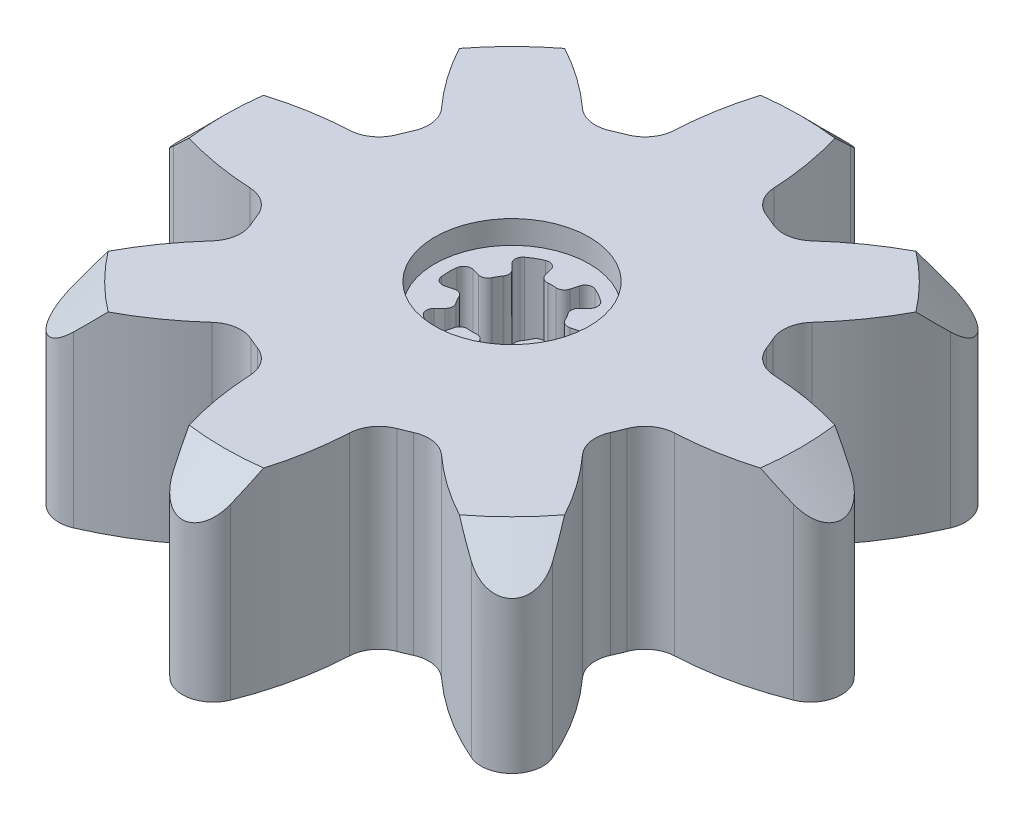
from build123d import *
from build123d.topology import SkipClean

# Parameters (mm, degrees)
SKETCH1_R               = 23.65
BOSS_EXTRUDE1_DEPTH     = 12.5
CHAMFER1_SIZE           = 5
CUT_EXTRUDE1_DEPTH      = 36.705671818
CUT_EXTRUDE3_DEPTH      = 9
CUT_EXTRUDE4_DEPTH      = 36.705671986
BOSS_EXTRUDE2_START     = 5
SKETCH3_5_R             = 5
BOSS_EXTRUDE2_DEPTH     = 5
CUT_EXTRUDE5_START      = -11
SKETCH3_7_R             = 5
CUT_EXTRUDE5_DEPTH      = 25.705671986
FILLET2_R               = 0.5
CUT_EXTRUDE6_DEPTH      = 38.747781517
CUT_EXTRUDE6_DEPTH_BACK = 38.747781517
FILLET3_R               = 2
FILLET4_R               = 2


with BuildPart() as part:
    # Sketch1 → Boss-Extrude1 (new body)
    with BuildSketch(Plane(origin=(0, 0, 0), x_dir=(1, 0, 0), z_dir=(0, 1, 0))):
        Circle(SKETCH1_R)
    extrude(amount=BOSS_EXTRUDE1_DEPTH)

    # Chamfer1
    chamfer1_edges = [part.edges().sort_by_distance(p)[0] for p in [
        (-23.65, 12.5, 0),
    ]]
    chamfer(chamfer1_edges, length=CHAMFER1_SIZE)

    # Sketch2 → Cut-Extrude1 (cut, through all)
    with BuildSketch(Plane(origin=(0, 12.5, 0), x_dir=(1, 0, 0), z_dir=(0, 1, 0))):
        with BuildLine():
            ThreePointArc((16.723075375, 16.723075375), (14.761157334, 11.338625506), (11.338457236, 6.742263159))
            Line((11.338457236, 6.742263159), (11.041486685, 6.445292607))
            ThreePointArc((11.041486685, 6.445292607), (11.811799823, 4.892607683), (12.365020218, 3.25))
            Line((12.365020218, 3.25), (12.785, 3.25))
            ThreePointArc((12.785, 3.25), (18.455333434, 2.420095464), (23.65, 0))
            ThreePointArc((23.65, 0), (21.849750944, 9.050463175), (16.723075375, 16.723075375))
        make_face()
        with BuildLine():
            ThreePointArc((6.742263159, 11.338457236), (11.338625506, 14.761157334), (16.723075375, 16.723075375))
            ThreePointArc((16.723075375, 16.723075375), (9.050463175, 21.849750944), (0, 23.65))
            ThreePointArc((0, 23.65), (2.420095464, 18.455333434), (3.25, 12.785))
            Line((3.25, 12.785), (3.25, 12.365020218))
            ThreePointArc((3.25, 12.365020218), (4.892607683, 11.811799823), (6.445292607, 11.041486685))
            Line((6.445292607, 11.041486685), (6.742263159, 11.338457236))
        make_face()
        with BuildLine():
            ThreePointArc((16.723075375, -16.723075375), (21.849750944, -9.050463175), (23.65, 0))
            ThreePointArc((23.65, 0), (18.455333434, -2.420095464), (12.785, -3.25))
            Line((12.785, -3.25), (12.365020218, -3.25))
            ThreePointArc((12.365020218, -3.25), (11.811799823, -4.892607683), (11.041486685, -6.445292607))
            Line((11.041486685, -6.445292607), (11.338457236, -6.742263159))
            ThreePointArc((11.338457236, -6.742263159), (14.761157334, -11.338625506), (16.723075375, -16.723075375))
        make_face()
        with BuildLine():
            ThreePointArc((-3.25, 12.785), (-2.420095464, 18.455333434), (0, 23.65))
            ThreePointArc((0, 23.65), (-9.050463175, 21.849750944), (-16.723075375, 16.723075375))
            ThreePointArc((-16.723075375, 16.723075375), (-11.338625506, 14.761157334), (-6.742263159, 11.338457236))
            Line((-6.742263159, 11.338457236), (-6.445292607, 11.041486685))
            ThreePointArc((-6.445292607, 11.041486685), (-4.892607683, 11.811799823), (-3.25, 12.365020218))
            Line((-3.25, 12.365020218), (-3.25, 12.785))
        make_face()
        with BuildLine():
            ThreePointArc((0, -23.65), (9.050463175, -21.849750944), (16.723075375, -16.723075375))
            ThreePointArc((16.723075375, -16.723075375), (11.338625506, -14.761157334), (6.742263159, -11.338457236))
            Line((6.742263159, -11.338457236), (6.445292607, -11.041486685))
            ThreePointArc((6.445292607, -11.041486685), (4.892607683, -11.811799823), (3.25, -12.365020218))
            Line((3.25, -12.365020218), (3.25, -12.785))
            ThreePointArc((3.25, -12.785), (2.420095464, -18.455333434), (0, -23.65))
        make_face()
        with BuildLine():
            ThreePointArc((-11.338457236, 6.742263159), (-14.761157334, 11.338625506), (-16.723075375, 16.723075375))
            ThreePointArc((-16.723075375, 16.723075375), (-21.849750944, 9.050463175), (-23.65, 0))
            ThreePointArc((-23.65, 0), (-18.455333434, 2.420095464), (-12.785, 3.25))
            Line((-12.785, 3.25), (-12.365020218, 3.25))
            ThreePointArc((-12.365020218, 3.25), (-11.811799823, 4.892607683), (-11.041486685, 6.445292607))
            Line((-11.041486685, 6.445292607), (-11.338457236, 6.742263159))
        make_face()
        with BuildLine():
            ThreePointArc((-16.723075375, -16.723075375), (-9.050463175, -21.849750944), (0, -23.65))
            ThreePointArc((0, -23.65), (-2.420095464, -18.455333434), (-3.25, -12.785))
            Line((-3.25, -12.785), (-3.25, -12.365020218))
            ThreePointArc((-3.25, -12.365020218), (-4.892607683, -11.811799823), (-6.445292607, -11.041486685))
            Line((-6.445292607, -11.041486685), (-6.742263159, -11.338457236))
            ThreePointArc((-6.742263159, -11.338457236), (-11.338625506, -14.761157334), (-16.723075375, -16.723075375))
        make_face()
        with BuildLine():
            ThreePointArc((-12.785, -3.25), (-18.455333434, -2.420095464), (-23.65, 0))
            ThreePointArc((-23.65, 0), (-21.849750944, -9.050463175), (-16.723075375, -16.723075375))
            ThreePointArc((-16.723075375, -16.723075375), (-14.761157334, -11.338625506), (-11.338457236, -6.742263159))
            Line((-11.338457236, -6.742263159), (-11.041486685, -6.445292607))
            ThreePointArc((-11.041486685, -6.445292607), (-11.811799823, -4.892607683), (-12.365020218, -3.25))
            Line((-12.365020218, -3.25), (-12.785, -3.25))
        make_face()
    extrude(amount=-CUT_EXTRUDE1_DEPTH, mode=Mode.SUBTRACT)

    # Sketch3 → Cut-Extrude3 (cut)
    with BuildSketch(Plane.XZ):
        with BuildLine():
            Line((1.061158085, 3.960295888), (0.672929517, 2.511407148))
            ThreePointArc((0.672929517, 2.511407148), (0, 2.6), (-0.672929517, 2.511407148))
            Line((-0.672929517, 2.511407148), (-1.061158085, 3.960295888))
            ThreePointArc((-1.061158085, 3.960295888), (-2.05, 3.550704156), (-2.899137803, 2.899137803))
            Line((-2.899137803, 2.899137803), (-1.838477631, 1.838477631))
            ThreePointArc((-1.838477631, 1.838477631), (-2.25166605, 1.3), (-2.511407148, 0.672929517))
            Line((-2.511407148, 0.672929517), (-3.960295888, 1.061158085))
            ThreePointArc((-3.960295888, 1.061158085), (-4.1, 0), (-3.960295888, -1.061158085))
            Line((-3.960295888, -1.061158085), (-2.511407148, -0.672929517))
            ThreePointArc((-2.511407148, -0.672929517), (-2.25166605, -1.3), (-1.838477631, -1.838477631))
            Line((-1.838477631, -1.838477631), (-2.899137803, -2.899137803))
            ThreePointArc((-2.899137803, -2.899137803), (-2.05, -3.550704156), (-1.061158085, -3.960295888))
            Line((-1.061158085, -3.960295888), (-0.672929517, -2.511407148))
            ThreePointArc((-0.672929517, -2.511407148), (0, -2.6), (0.672929517, -2.511407148))
            Line((0.672929517, -2.511407148), (1.061158085, -3.960295888))
            ThreePointArc((1.061158085, -3.960295888), (2.05, -3.550704156), (2.899137803, -2.899137803))
            Line((2.899137803, -2.899137803), (1.838477631, -1.838477631))
            ThreePointArc((1.838477631, -1.838477631), (2.25166605, -1.3), (2.511407148, -0.672929517))
            Line((2.511407148, -0.672929517), (3.960295888, -1.061158085))
            ThreePointArc((3.960295888, -1.061158085), (4.1, 0), (3.960295888, 1.061158085))
            Line((3.960295888, 1.061158085), (2.511407148, 0.672929517))
            ThreePointArc((2.511407148, 0.672929517), (2.25166605, 1.3), (1.838477631, 1.838477631))
            Line((1.838477631, 1.838477631), (2.899137803, 2.899137803))
            ThreePointArc((2.899137803, 2.899137803), (2.05, 3.550704156), (1.061158085, 3.960295888))
        make_face()
        with BuildLine():
            Line((4.301795716, 2.54844141), (9.819871729, 4.844854922))
            ThreePointArc((9.819871729, 4.844854922), (9.594019108, 5.278001265), (9.349072854, 5.70064354))
            ThreePointArc((9.349072854, 5.70064354), (9.209371452, 6.335099743), (9.488977032, 6.921505638))
            ThreePointArc((9.488977032, 6.921505638), (12.083864169, 10.129242791), (14.021999626, 13.771583776))
            ThreePointArc((14.021999626, 13.771583776), (13.979017454, 13.989358062), (13.761438196, 14.03331683))
            ThreePointArc((13.761438196, 14.03331683), (10.106194816, 12.10405139), (6.88994001, 9.508174981))
            ThreePointArc((6.88994001, 9.508174981), (6.305066553, 9.228736664), (5.671709274, 9.36665436))
            ThreePointArc((5.671709274, 9.36665436), (5.247197229, 9.610901167), (4.812188077, 9.835921203))
            Line((4.812188077, 9.835921203), (2.534128676, 4.310242667))
            ThreePointArc((2.534128676, 4.310242667), (3.529653169, 3.541404878), (4.301795716, 2.54844141))
        make_face()
        with BuildLine():
            ThreePointArc((10.633728904, 2.612720726), (10.506262131, 3.085604645), (10.357777404, 3.55231576))
            Line((10.357777404, 3.55231576), (4.83970139, 1.255902247))
            ThreePointArc((4.83970139, 1.255902247), (4.999993095, 0.008309713), (4.843849124, -1.23980872))
            Line((4.843849124, -1.23980872), (10.36952766, -3.517868121))
            ThreePointArc((10.36952766, -3.517868121), (10.516106456, -3.051885485), (10.641756517, -2.579829109))
            ThreePointArc((10.641756517, -2.579829109), (10.991600992, -2.032417017), (11.603963579, -1.815476434))
            ThreePointArc((11.603963579, -1.815476434), (15.707038563, -1.382126031), (19.653031297, -0.177070746))
            ThreePointArc((19.653031297, -0.177070746), (19.776627986, 0.007311914), (19.653859761, 0.192247226))
            ThreePointArc((19.653859761, 0.192247226), (15.705015704, 1.412697932), (11.595218309, 1.851371703))
            ThreePointArc((11.595218309, 1.851371703), (10.984057593, 2.067346962), (10.633728904, 2.612720726))
        make_face()
        with BuildLine():
            ThreePointArc((-1.255902247, 4.83970139), (-0.008309713, 4.999993095), (1.23980872, 4.843849124))
            Line((1.23980872, 4.843849124), (3.517868121, 10.36952766))
            ThreePointArc((3.517868121, 10.36952766), (3.051885485, 10.516106456), (2.579829109, 10.641756517))
            ThreePointArc((2.579829109, 10.641756517), (2.032417017, 10.991600992), (1.815476434, 11.603963579))
            ThreePointArc((1.815476434, 11.603963579), (1.382126031, 15.707038563), (0.177070746, 19.653031297))
            ThreePointArc((0.177070746, 19.653031297), (-0.007311914, 19.776627986), (-0.192247226, 19.653859761))
            ThreePointArc((-0.192247226, 19.653859761), (-1.412697932, 15.705015704), (-1.851371703, 11.595218309))
            ThreePointArc((-1.851371703, 11.595218309), (-2.067346962, 10.984057593), (-2.612720726, 10.633728904))
            ThreePointArc((-2.612720726, 10.633728904), (-3.085604645, 10.506262131), (-3.55231576, 10.357777404))
            Line((-3.55231576, 10.357777404), (-1.255902247, 4.83970139))
        make_face()
        with BuildLine():
            Line((9.835921203, -4.812188077), (4.310242667, -2.534128676))
            ThreePointArc((4.310242667, -2.534128676), (3.541404878, -3.529653169), (2.54844141, -4.301795716))
            Line((2.54844141, -4.301795716), (4.844854922, -9.819871729))
            ThreePointArc((4.844854922, -9.819871729), (5.278001265, -9.594019108), (5.70064354, -9.349072854))
            ThreePointArc((5.70064354, -9.349072854), (6.335099743, -9.209371452), (6.921505638, -9.488977032))
            ThreePointArc((6.921505638, -9.488977032), (10.129242791, -12.083864169), (13.771583776, -14.021999626))
            ThreePointArc((13.771583776, -14.021999626), (13.989358062, -13.979017454), (14.03331683, -13.761438196))
            ThreePointArc((14.03331683, -13.761438196), (12.10405139, -10.106194816), (9.508174981, -6.88994001))
            ThreePointArc((9.508174981, -6.88994001), (9.228736664, -6.305066553), (9.36665436, -5.671709274))
            ThreePointArc((9.36665436, -5.671709274), (9.610901167, -5.247197229), (9.835921203, -4.812188077))
        make_face()
        with BuildLine():
            ThreePointArc((-4.310242667, 2.534128676), (-3.541404878, 3.529653169), (-2.54844141, 4.301795716))
            Line((-2.54844141, 4.301795716), (-4.844854922, 9.819871729))
            ThreePointArc((-4.844854922, 9.819871729), (-5.278001265, 9.594019108), (-5.70064354, 9.349072854))
            ThreePointArc((-5.70064354, 9.349072854), (-6.335099743, 9.209371452), (-6.921505638, 9.488977032))
            ThreePointArc((-6.921505638, 9.488977032), (-10.129242791, 12.083864169), (-13.771583776, 14.021999626))
            ThreePointArc((-13.771583776, 14.021999626), (-13.989358062, 13.979017454), (-14.03331683, 13.761438196))
            ThreePointArc((-14.03331683, 13.761438196), (-12.10405139, 10.106194816), (-9.508174981, 6.88994001))
            ThreePointArc((-9.508174981, 6.88994001), (-9.228736664, 6.305066553), (-9.36665436, 5.671709274))
            ThreePointArc((-9.36665436, 5.671709274), (-9.610901167, 5.247197229), (-9.835921203, 4.812188077))
            Line((-9.835921203, 4.812188077), (-4.310242667, 2.534128676))
        make_face()
        with BuildLine():
            Line((3.55231576, -10.357777404), (1.255902247, -4.83970139))
            ThreePointArc((1.255902247, -4.83970139), (0.008309713, -4.999993095), (-1.23980872, -4.843849124))
            Line((-1.23980872, -4.843849124), (-3.517868121, -10.36952766))
            ThreePointArc((-3.517868121, -10.36952766), (-3.051885485, -10.516106456), (-2.579829109, -10.641756517))
            ThreePointArc((-2.579829109, -10.641756517), (-2.032417017, -10.991600992), (-1.815476434, -11.603963579))
            ThreePointArc((-1.815476434, -11.603963579), (-1.382126031, -15.707038563), (-0.177070746, -19.653031297))
            ThreePointArc((-0.177070746, -19.653031297), (0.007311914, -19.776627986), (0.192247226, -19.653859761))
            ThreePointArc((0.192247226, -19.653859761), (1.412697932, -15.705015704), (1.851371703, -11.595218309))
            ThreePointArc((1.851371703, -11.595218309), (2.067346962, -10.984057593), (2.612720726, -10.633728904))
            ThreePointArc((2.612720726, -10.633728904), (3.085604645, -10.506262131), (3.55231576, -10.357777404))
        make_face()
        with BuildLine():
            ThreePointArc((-4.83970139, -1.255902247), (-4.999993095, -0.008309713), (-4.843849124, 1.23980872))
            Line((-4.843849124, 1.23980872), (-10.36952766, 3.517868121))
            ThreePointArc((-10.36952766, 3.517868121), (-10.516106456, 3.051885485), (-10.641756517, 2.579829109))
            ThreePointArc((-10.641756517, 2.579829109), (-10.991600992, 2.032417017), (-11.603963579, 1.815476434))
            ThreePointArc((-11.603963579, 1.815476434), (-15.707038563, 1.382126031), (-19.653031297, 0.177070746))
            ThreePointArc((-19.653031297, 0.177070746), (-19.776627986, -0.007311914), (-19.653859761, -0.192247226))
            ThreePointArc((-19.653859761, -0.192247226), (-15.705015704, -1.412697932), (-11.595218309, -1.851371703))
            ThreePointArc((-11.595218309, -1.851371703), (-10.984057593, -2.067346962), (-10.633728904, -2.612720726))
            ThreePointArc((-10.633728904, -2.612720726), (-10.506262131, -3.085604645), (-10.357777404, -3.55231576))
            Line((-10.357777404, -3.55231576), (-4.83970139, -1.255902247))
        make_face()
        with BuildLine():
            Line((-4.812188077, -9.835921203), (-2.534128676, -4.310242667))
            ThreePointArc((-2.534128676, -4.310242667), (-3.529653169, -3.541404878), (-4.301795716, -2.54844141))
            Line((-4.301795716, -2.54844141), (-9.819871729, -4.844854922))
            ThreePointArc((-9.819871729, -4.844854922), (-9.594019108, -5.278001265), (-9.349072854, -5.70064354))
            ThreePointArc((-9.349072854, -5.70064354), (-9.209371452, -6.335099743), (-9.488977032, -6.921505638))
            ThreePointArc((-9.488977032, -6.921505638), (-12.083864169, -10.129242791), (-14.021999626, -13.771583776))
            ThreePointArc((-14.021999626, -13.771583776), (-13.979017454, -13.989358062), (-13.761438196, -14.03331683))
            ThreePointArc((-13.761438196, -14.03331683), (-10.106194816, -12.10405139), (-6.88994001, -9.508174981))
            ThreePointArc((-6.88994001, -9.508174981), (-6.305066553, -9.228736664), (-5.671709274, -9.36665436))
            ThreePointArc((-5.671709274, -9.36665436), (-5.247197229, -9.610901167), (-4.812188077, -9.835921203))
        make_face()
    extrude(amount=-CUT_EXTRUDE3_DEPTH, mode=Mode.SUBTRACT)

    # Sketch3<4> → Cut-Extrude4 (cut, through all)
    with BuildSketch(Plane.XZ):
        with BuildLine():
            Line((1.061158085, 3.960295888), (0.672929517, 2.511407148))
            ThreePointArc((0.672929517, 2.511407148), (0, 2.6), (-0.672929517, 2.511407148))
            Line((-0.672929517, 2.511407148), (-1.061158085, 3.960295888))
            ThreePointArc((-1.061158085, 3.960295888), (-2.05, 3.550704156), (-2.899137803, 2.899137803))
            Line((-2.899137803, 2.899137803), (-1.838477631, 1.838477631))
            ThreePointArc((-1.838477631, 1.838477631), (-2.25166605, 1.3), (-2.511407148, 0.672929517))
            Line((-2.511407148, 0.672929517), (-3.960295888, 1.061158085))
            ThreePointArc((-3.960295888, 1.061158085), (-4.1, 0), (-3.960295888, -1.061158085))
            Line((-3.960295888, -1.061158085), (-2.511407148, -0.672929517))
            ThreePointArc((-2.511407148, -0.672929517), (-2.25166605, -1.3), (-1.838477631, -1.838477631))
            Line((-1.838477631, -1.838477631), (-2.899137803, -2.899137803))
            ThreePointArc((-2.899137803, -2.899137803), (-2.05, -3.550704156), (-1.061158085, -3.960295888))
            Line((-1.061158085, -3.960295888), (-0.672929517, -2.511407148))
            ThreePointArc((-0.672929517, -2.511407148), (0, -2.6), (0.672929517, -2.511407148))
            Line((0.672929517, -2.511407148), (1.061158085, -3.960295888))
            ThreePointArc((1.061158085, -3.960295888), (2.05, -3.550704156), (2.899137803, -2.899137803))
            Line((2.899137803, -2.899137803), (1.838477631, -1.838477631))
            ThreePointArc((1.838477631, -1.838477631), (2.25166605, -1.3), (2.511407148, -0.672929517))
            Line((2.511407148, -0.672929517), (3.960295888, -1.061158085))
            ThreePointArc((3.960295888, -1.061158085), (4.064923932, -0.535157388), (4.1, 0))
            ThreePointArc((4.1, 0), (4.064923932, 0.535157388), (3.960295888, 1.061158085))
            Line((3.960295888, 1.061158085), (2.511407148, 0.672929517))
            ThreePointArc((2.511407148, 0.672929517), (2.25166605, 1.3), (1.838477631, 1.838477631))
            Line((1.838477631, 1.838477631), (2.899137803, 2.899137803))
            ThreePointArc((2.899137803, 2.899137803), (2.05, 3.550704156), (1.061158085, 3.960295888))
        make_face()
    extrude(amount=-CUT_EXTRUDE4_DEPTH, mode=Mode.SUBTRACT)

    # Sketch3<5> → Boss-Extrude2 (add)
    with SkipClean():  # the faces are left unmerged after this step: merging them gives an invalid solid
        with BuildSketch(Plane.XZ.offset(BOSS_EXTRUDE2_START)):
            Circle(SKETCH3_5_R)
            with BuildLine():
                ThreePointArc((-0.672929517, 2.511407148), (0, 2.6), (0.672929517, 2.511407148))
                Line((0.672929517, 2.511407148), (1.061158085, 3.960295888))
                ThreePointArc((1.061158085, 3.960295888), (2.05, 3.550704156), (2.899137803, 2.899137803))
                Line((2.899137803, 2.899137803), (1.838477631, 1.838477631))
                ThreePointArc((1.838477631, 1.838477631), (2.25166605, 1.3), (2.511407148, 0.672929517))
                Line((2.511407148, 0.672929517), (3.960295888, 1.061158085))
                ThreePointArc((3.960295888, 1.061158085), (4.1, 0), (3.960295888, -1.061158085))
                Line((3.960295888, -1.061158085), (2.511407148, -0.672929517))
                ThreePointArc((2.511407148, -0.672929517), (2.25166605, -1.3), (1.838477631, -1.838477631))
                Line((1.838477631, -1.838477631), (2.899137803, -2.899137803))
                ThreePointArc((2.899137803, -2.899137803), (2.05, -3.550704156), (1.061158085, -3.960295888))
                Line((1.061158085, -3.960295888), (0.672929517, -2.511407148))
                ThreePointArc((0.672929517, -2.511407148), (0, -2.6), (-0.672929517, -2.511407148))
                Line((-0.672929517, -2.511407148), (-1.061158085, -3.960295888))
                ThreePointArc((-1.061158085, -3.960295888), (-2.05, -3.550704156), (-2.899137803, -2.899137803))
                Line((-2.899137803, -2.899137803), (-1.838477631, -1.838477631))
                ThreePointArc((-1.838477631, -1.838477631), (-2.25166605, -1.3), (-2.511407148, -0.672929517))
                Line((-2.511407148, -0.672929517), (-3.960295888, -1.061158085))
                ThreePointArc((-3.960295888, -1.061158085), (-4.1, 0), (-3.960295888, 1.061158085))
                Line((-3.960295888, 1.061158085), (-2.511407148, 0.672929517))
                ThreePointArc((-2.511407148, 0.672929517), (-2.25166605, 1.3), (-1.838477631, 1.838477631))
                Line((-1.838477631, 1.838477631), (-2.899137803, 2.899137803))
                ThreePointArc((-2.899137803, 2.899137803), (-2.05, 3.550704156), (-1.061158085, 3.960295888))
                Line((-1.061158085, 3.960295888), (-0.672929517, 2.511407148))
            make_face(mode=Mode.SUBTRACT)
        extrude(amount=-BOSS_EXTRUDE2_DEPTH)

    # Sketch3<7> → Cut-Extrude5 (cut, through all)
    with SkipClean():  # the faces are left unmerged after this step: merging them gives an invalid solid
        with BuildSketch(Plane.XZ.offset(CUT_EXTRUDE5_START)):
            Circle(SKETCH3_7_R)
            with BuildLine():
                ThreePointArc((-0.672929517, 2.511407148), (0, 2.6), (0.672929517, 2.511407148))
                Line((0.672929517, 2.511407148), (1.061158085, 3.960295888))
                ThreePointArc((1.061158085, 3.960295888), (2.05, 3.550704156), (2.899137803, 2.899137803))
                Line((2.899137803, 2.899137803), (1.838477631, 1.838477631))
                ThreePointArc((1.838477631, 1.838477631), (2.25166605, 1.3), (2.511407148, 0.672929517))
                Line((2.511407148, 0.672929517), (3.960295888, 1.061158085))
                ThreePointArc((3.960295888, 1.061158085), (4.1, 0), (3.960295888, -1.061158085))
                Line((3.960295888, -1.061158085), (2.511407148, -0.672929517))
                ThreePointArc((2.511407148, -0.672929517), (2.25166605, -1.3), (1.838477631, -1.838477631))
                Line((1.838477631, -1.838477631), (2.899137803, -2.899137803))
                ThreePointArc((2.899137803, -2.899137803), (2.05, -3.550704156), (1.061158085, -3.960295888))
                Line((1.061158085, -3.960295888), (0.672929517, -2.511407148))
                ThreePointArc((0.672929517, -2.511407148), (0, -2.6), (-0.672929517, -2.511407148))
                Line((-0.672929517, -2.511407148), (-1.061158085, -3.960295888))
                ThreePointArc((-1.061158085, -3.960295888), (-2.05, -3.550704156), (-2.899137803, -2.899137803))
                Line((-2.899137803, -2.899137803), (-1.838477631, -1.838477631))
                ThreePointArc((-1.838477631, -1.838477631), (-2.25166605, -1.3), (-2.511407148, -0.672929517))
                Line((-2.511407148, -0.672929517), (-3.960295888, -1.061158085))
                ThreePointArc((-3.960295888, -1.061158085), (-4.1, 0), (-3.960295888, 1.061158085))
                Line((-3.960295888, 1.061158085), (-2.511407148, 0.672929517))
                ThreePointArc((-2.511407148, 0.672929517), (-2.25166605, 1.3), (-1.838477631, 1.838477631))
                Line((-1.838477631, 1.838477631), (-2.899137803, 2.899137803))
                ThreePointArc((-2.899137803, 2.899137803), (-2.05, 3.550704156), (-1.061158085, 3.960295888))
                Line((-1.061158085, 3.960295888), (-0.672929517, 2.511407148))
            make_face(mode=Mode.SUBTRACT)
        extrude(amount=-CUT_EXTRUDE5_DEPTH, mode=Mode.SUBTRACT)

    # Fillet2
    fillet2_edges = [part.edges().sort_by_distance(p)[0] for p in [
        (-2.511407148, 5.5, -0.672929517),
        (2.511407148, 5.5, 0.672929517),
        (0.672929517, 5.5, 2.511407148),
        (-0.672929517, 5.5, -2.511407148),
        (-1.838477631, 5.5, 1.838477631),
        (1.838477631, 5.5, -1.838477631),
        (-2.899137803, 5.5, 2.899137803),
        (2.899137803, 5.5, -2.899137803),
        (-1.061158085, 5.5, 3.960295888),
        (1.061158085, 5.5, -3.960295888),
        (-3.960295888, 5.5, -1.061158085),
        (3.960295888, 5.5, 1.061158085),
        (2.899137803, 5.5, 2.899137803),
        (-2.899137803, 5.5, -2.899137803),
        (1.061158085, 5.5, 3.960295888),
        (-1.061158085, 5.5, -3.960295888),
        (-0.672929517, 5.5, 2.511407148),
        (0.672929517, 5.5, -2.511407148),
        (-3.960295888, 5.5, 1.061158085),
        (3.960295888, 5.5, -1.061158085),
        (1.838477631, 5.5, 1.838477631),
        (-1.838477631, 5.5, -1.838477631),
        (-2.511407148, 5.5, 0.672929517),
        (2.511407148, 5.5, -0.672929517),
    ]]
    fillet(fillet2_edges, radius=FILLET2_R)

    # Sketch5 → Cut-Extrude6 (cut, two sides: drawn at the far end of the back side and taken through both)
    with SkipClean():  # the faces are left unmerged after this step: merging them gives an invalid solid
        with BuildSketch(Plane(origin=(0, 12.5, 0), x_dir=(1, 0, 0), z_dir=(0, 1, 0)).offset(-CUT_EXTRUDE6_DEPTH_BACK)):
            with BuildLine():
                ThreePointArc((0.003500293, 20.98513785), (-0.703606488, 19.278031069), (1.003500293, 19.98513785))
                ThreePointArc((1.003500293, 19.98513785), (0.710607074, 20.692244631), (0.003500293, 20.98513785))
            make_face()
        extrude(amount=CUT_EXTRUDE6_DEPTH + CUT_EXTRUDE6_DEPTH_BACK, mode=Mode.SUBTRACT)

    # Fillet3
    fillet3_edges = [part.edges().sort_by_distance(p)[0] for p in [
        (23.65, 3.75, 0),
        (16.723075375, 3.75, 16.723075375),
        (12.365020218, 6.25, 3.25),
        (11.041486685, 6.25, 6.445292607),
        (16.723075375, 3.75, -16.723075375),
        (6.445292607, 6.25, -11.041486685),
        (11.041486685, 6.25, -6.445292607),
        (12.365020218, 6.25, -3.25),
        (3.25, 6.25, -12.365020218),
        (-6.445292607, 6.25, -11.041486685),
        (-3.25, 6.25, -12.365020218),
        (-16.723075375, 3.75, -16.723075375),
        (-11.041486685, 6.25, -6.445292607),
        (-12.365020218, 6.25, -3.25),
        (-23.65, 3.75, 0),
        (-11.041486685, 6.25, 6.445292607),
        (-12.365020218, 6.25, 3.25),
        (-16.723075375, 3.75, 16.723075375),
        (-6.445292607, 6.25, 11.041486685),
        (-3.25, 6.25, 12.365020218),
        (6.445292607, 6.25, 11.041486685),
        (3.25, 6.25, 12.365020218),
        (0, 3.75, 23.65),
    ]]
    fillet(fillet3_edges, radius=FILLET3_R)

    # Fillet4
    fillet4_edges = [part.edges().sort_by_distance(p)[0] for p in [
        (0, 3.75, -23.65),
    ]]
    fillet(fillet4_edges, radius=FILLET4_R)


solid = part.part
